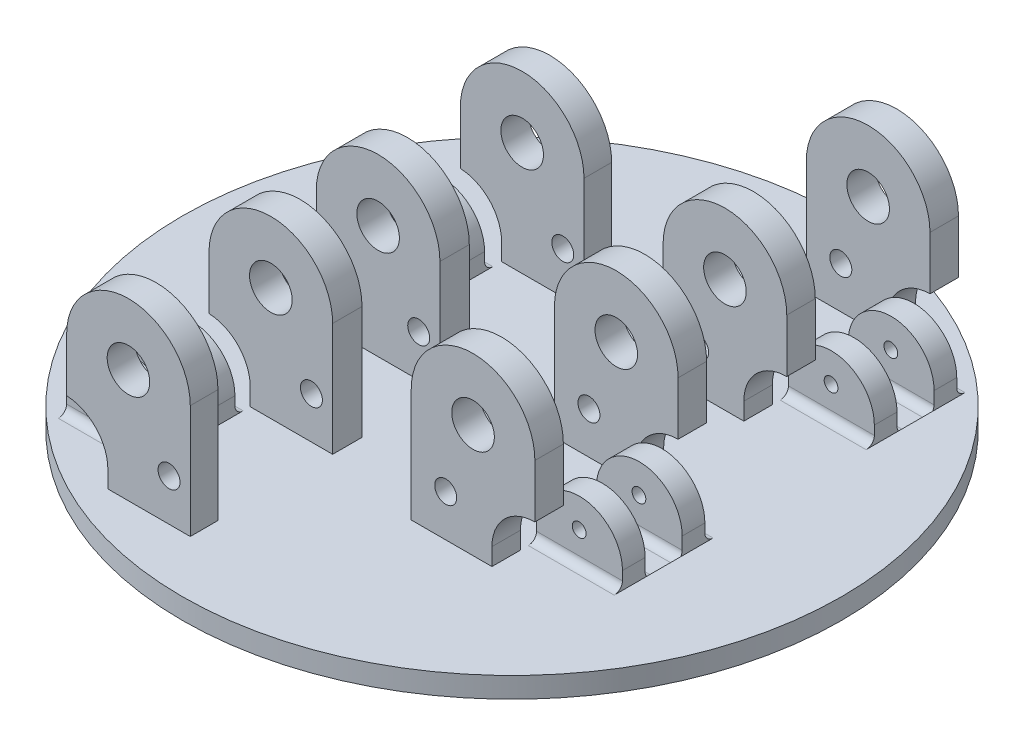
from build123d import *

# Parameters (mm, degrees)
SKETCH_1_R           = 48
SKETCH_1_R_2         = 1
EXTRUDE_1_DEPTH      = 2.5
SKETCH_11_W          = 18
SKETCH_11_H          = 25
EXTRUDE_13_DEPTH     = 26
CUT_EXTRUDE_19_DEPTH = 90.150131199
CUT_EXTRUDE_23_DEPTH = 26
SKETCH_12_10_R       = 3.1
SKETCH_12_10_R_2     = 1.6
CUT_EXTRUDE_24_DEPTH = 90.150131199
CUT_EXTRUDE_25_DEPTH = 90.150131199
CUT_EXTRUDE_26_DEPTH = 105.076574524
CUT_EXTRUDE_31_REACH = 102.393
CUT_EXTRUDE_30_REACH = 102.393
SKETCH_20_R          = 1
EXTRUDE_18_DEPTH     = 6
CUT_EXTRUDE_33_REACH = 107.214
SKETCH_21_W          = 5.4
SKETCH_21_H          = 18.025658934
SKETCH_24_R          = 3.1
SKETCH_24_R_2        = 1.6
CUT_EXTRUDE_35_DEPTH = 105.21252324
CUT_EXTRUDE_40_REACH = 102.393
SKETCH_26_W          = 16.7
SKETCH_26_H          = 31.404464931
SKETCH_27_R          = 1
EXTRUDE_20_DEPTH     = 6
CUT_EXTRUDE_41_REACH = 108.681
CUT_EXTRUDE_42_REACH = 90.175
EXTRUDE_21_DEPTH     = 11.5
SKETCH_35_R          = 1.4
CUT_EXTRUDE_43_DEPTH = 109.442477281
CUT_EXTRUDE_44_DEPTH = 80.369297247
EXTRUDE_22_DEPTH     = 8
FILLET_9_R           = 2
CUT_EXTRUDE_45_REACH = 98.187
FILLET_10_R          = 2
CUT_EXTRUDE_46_REACH = 96.57
FILLET_12_R          = 1.2
SKETCH_40_R          = 48
SKETCH_40_W          = 12.5
SKETCH_40_H          = 5.4
SKETCH_40_W_2        = 12.499987058
EXTRUDE_23_DEPTH     = 0.5
FILLET_13_R          = 1.2


with BuildPart() as part:
    # 草图1 → 凸台-拉伸1 (new body)
    with BuildSketch(Plane(origin=(0, 0, 0), x_dir=(1, 0, 0), z_dir=(0, 1, 0))):
        with Locations(Location((0, -14.75, 0), (0, 0, 270))):
            Circle(SKETCH_1_R)
        with Locations(Location((-27, -5.58, 0), (0, 0, 270))):
            Circle(SKETCH_1_R_2, mode=Mode.SUBTRACT)
        with Locations(Location((-27, -42.25, 0), (0, 0, 270))):
            Circle(SKETCH_1_R_2, mode=Mode.SUBTRACT)
        with Locations(Location((27, 12.75, 0), (0, 0, 270))):
            Circle(SKETCH_1_R_2, mode=Mode.SUBTRACT)
        with Locations(Location((27, -23.92, 0), (0, 0, 270))):
            Circle(SKETCH_1_R_2, mode=Mode.SUBTRACT)
    extrude(amount=EXTRUDE_1_DEPTH)

    # 草图11 → 凸台-拉伸13 (add)
    with BuildSketch(Plane(origin=(0, 2.5, 0), x_dir=(1, 0, 0), z_dir=(0, 1, 0))):
        with Locations((-16, -5.741037321)):
            Rectangle(SKETCH_11_W, SKETCH_11_H)
        with Locations((-16, -42.088962679)):
            Rectangle(SKETCH_11_W, SKETCH_11_H)
        with Locations((16, 12.75)):
            Rectangle(SKETCH_11_W, SKETCH_11_H)
        with Locations((16, -23.92)):
            Rectangle(SKETCH_11_W, SKETCH_11_H)
    extrude(amount=EXTRUDE_13_DEPTH)

    # 草图12 → 切除-拉伸19 (cut, through all)
    with BuildSketch(Plane(origin=(0, 0, -6.758962679), x_dir=(-1, 0, 0), z_dir=(0, 0, -1))):
        with BuildLine():
            ThreePointArc((7, 19.5), (9.636038969, 25.863961031), (16, 28.5))
            Line((16, 28.5), (7, 28.5))
            Line((7, 28.5), (7, 19.5))
        make_face()
    extrude(amount=-CUT_EXTRUDE_19_DEPTH, mode=Mode.SUBTRACT)

    # 草图12<9> → 切除-拉伸23 (cut)
    with BuildSketch(Plane(origin=(0, 0, -6.758962679), x_dir=(-1, 0, 0), z_dir=(0, 0, -1))):
        with BuildLine():
            ThreePointArc((16, 28.5), (22.363961031, 25.863961031), (25, 19.5))
            Line((25, 19.5), (25, 28.5))
            Line((25, 28.5), (16, 28.5))
        make_face()
    extrude(amount=-CUT_EXTRUDE_23_DEPTH, mode=Mode.SUBTRACT)

    # 草图12<10> → 切除-拉伸24 (cut, through all)
    with BuildSketch(Plane(origin=(0, 0, -6.758962679), x_dir=(-1, 0, 0), z_dir=(0, 0, -1))):
        with Locations((16, 19.5)):
            Circle(SKETCH_12_10_R)
        with Locations((10.09, 9.09)):
            Circle(SKETCH_12_10_R_2)
    extrude(amount=-CUT_EXTRUDE_24_DEPTH, mode=Mode.SUBTRACT)

    # 草图12<11> → 切除-拉伸25 (cut, through all)
    with BuildSketch(Plane(origin=(0, 0, -6.758962679), x_dir=(-1, 0, 0), z_dir=(0, 0, -1))):
        with BuildLine():
            Line((25, 2.5), (25, 11.744997998))
            ThreePointArc((25, 11.744997998), (20.743060906, 9.830127019), (19, 5.5))
            Line((19, 5.5), (19, 2.5))
            Line((19, 2.5), (25, 2.5))
        make_face()
    extrude(amount=-CUT_EXTRUDE_25_DEPTH, mode=Mode.SUBTRACT)

    # 草图13 → 切除-拉伸26 (cut, through all)
    with BuildSketch(Plane.XY.offset(54.588962679)):
        with BuildLine():
            Line((-25, 19.5), (-25, 28.5))
            Line((-25, 28.5), (-16, 28.5))
            ThreePointArc((-16, 28.5), (-22.363961031, 25.863961031), (-25, 19.5))
        make_face()
    extrude(amount=-CUT_EXTRUDE_26_DEPTH, mode=Mode.SUBTRACT)

    # 草图17 → 切除-拉伸31 (cut, up to next)
    with BuildSketch(Plane.ZY.offset(25), mode=Mode.PRIVATE) as cut_extrude_31_sk1:
        Polygon((50.559935794, 10.244997998), (50.559935794, 33.039194052), (33.859935794, 33.039194052), (33.859935794, 10.244997998), (33.859935794, 2.5), (50.559935794, 2.5), align=None)
    cut_extrude_31_tool1 = extrude(cut_extrude_31_sk1.sketch, amount=-CUT_EXTRUDE_31_REACH, mode=Mode.PRIVATE) & part.part
    add(cut_extrude_31_tool1.solids().sort_by_distance((-25, 17.769597, 42.209936))[0], mode=Mode.SUBTRACT)

    # 草图16 → 切除-拉伸30 (cut, up to next)
    with BuildSketch(Plane.ZY.offset(25), mode=Mode.PRIVATE) as cut_extrude_30_sk1:
        Polygon((13.970064206, 10.244997998), (13.970064206, 31.921887842), (-2.729935794, 31.921887842), (-2.729935794, 10.244997998), (-2.729935794, 2.5), (13.970064206, 2.5), align=None)
    cut_extrude_30_tool1 = extrude(cut_extrude_30_sk1.sketch, amount=-CUT_EXTRUDE_30_REACH, mode=Mode.PRIVATE) & part.part
    add(cut_extrude_30_tool1.solids().sort_by_distance((-25, 17.210944, 5.620064))[0], mode=Mode.SUBTRACT)

    # 草图20 → 凸台-拉伸18 (add, symmetric)
    with BuildSketch(Plane(origin=(0, 0, 5.741037321), x_dir=(-1, 0, 0), z_dir=(0, 0, -1))):
        with BuildLine():
            Line((31.5, 2.5), (19, 2.5))
            Line((19, 2.5), (19, 5.5))
            ThreePointArc((19, 5.5), (20.743060906, 9.830127019), (25, 11.744997998))
            ThreePointArc((25, 11.744997998), (29.580127019, 10.006939094), (31.5, 5.5))
            Line((31.5, 5.5), (31.5, 2.5))
        make_face()
        with Locations((25.314451677, 7.498961226)):
            Circle(SKETCH_20_R, mode=Mode.SUBTRACT)
    extrude_18 = extrude(amount=EXTRUDE_18_DEPTH, both=True)

    # 草图21 → 切除-拉伸33 (cut, up to next)
    with BuildSketch(Plane.ZY.offset(31.5), mode=Mode.PRIVATE) as cut_extrude_33_sk1:
        with Locations((5.795064206, 11.512829467)):
            Rectangle(SKETCH_21_W, SKETCH_21_H)
    cut_extrude_33_tool1 = extrude(cut_extrude_33_sk1.sketch, amount=-CUT_EXTRUDE_33_REACH, mode=Mode.PRIVATE) & part.part
    cut_extrude_33 = cut_extrude_33_tool1.solids().sort_by_distance((-31.5, 11.512829, 5.795064))[0]
    add(cut_extrude_33, mode=Mode.SUBTRACT)

    # 镜向2: 凸台-拉伸18 across plane
    add(extrude_18.mirror(Plane(origin=(0, 0, 23.915), x_dir=(1, 0, 0), z_dir=(0, 0, -1))))

    # 镜向5: 切除-拉伸33 across plane
    add(cut_extrude_33.mirror(Plane(origin=(0, 0, 23.915), x_dir=(1, 0, 0), z_dir=(0, 0, -1))), mode=Mode.SUBTRACT)

    # 草图24 → 切除-拉伸35 (cut, through all)
    with BuildSketch(Plane(origin=(0, 0, -25.25), x_dir=(-1, 0, 0), z_dir=(0, 0, -1))):
        with BuildLine():
            Line((-15.999999984, 28.5), (-25, 28.5))
            Line((-25, 28.5), (-25, 19.5))
            ThreePointArc((-25, 19.5), (-22.363961025, 25.863961036), (-15.999999984, 28.5))
        make_face()
        with BuildLine():
            Line((-7, 28.5), (-15.999999984, 28.5))
            ThreePointArc((-15.999999984, 28.5), (-9.636038964, 25.863961025), (-7, 19.5))
            Line((-7, 19.5), (-7, 28.5))
        make_face()
        with BuildLine():
            ThreePointArc((-18.750012942, 5.512719086), (-20.585081784, 9.923911973), (-25, 11.75))
            Line((-25, 11.75), (-25, 2.5))
            Line((-25, 2.5), (-18.750012942, 2.5))
            Line((-18.750012942, 2.5), (-18.750012942, 5.512719086))
        make_face()
        with Locations((-16, 19.5)):
            Circle(SKETCH_24_R)
        with Locations((-12.020744663, 9.09)):
            Circle(SKETCH_24_R_2)
    extrude(amount=-CUT_EXTRUDE_35_DEPTH, mode=Mode.SUBTRACT)

    # 切除-拉伸40: up to this face of the body (flat: up to its plane)
    cut_extrude_40_end = Plane(part.part.faces().sort_by_distance((7, 11, 23.92))[0])
    # 草图26 → 切除-拉伸40 (cut, up to the picked face)
    with BuildSketch(Plane(origin=(25, 0, 0), x_dir=(0, 0, -1), z_dir=(1, 0, 0)), mode=Mode.PRIVATE) as cut_extrude_40_sk1:
        with Locations((-23.92, 18.202232465)):
            Rectangle(SKETCH_26_W, SKETCH_26_H)
    cut_extrude_40_tool1 = split(extrude(cut_extrude_40_sk1.sketch, amount=-CUT_EXTRUDE_40_REACH, mode=Mode.PRIVATE), bisect_by=cut_extrude_40_end, keep=Keep.BOTH, mode=Mode.PRIVATE)
    add(cut_extrude_40_tool1.solids().sort_by(Axis((25, 18.202232, 23.92), (-1, 0, 0)))[0], mode=Mode.SUBTRACT)

    # 草图27 → 凸台-拉伸20 (add, symmetric)
    with BuildSketch(Plane(origin=(0, 0, 23.92), x_dir=(-1, 0, 0), z_dir=(0, 0, -1))):
        with BuildLine():
            ThreePointArc((-25, 11.75), (-29.419417382, 9.919417382), (-31.25, 5.5))
            Line((-31.25, 5.5), (-31.25, 2.5))
            Line((-31.25, 2.5), (-18.750012942, 2.5))
            Line((-18.750012942, 2.5), (-18.750012942, 5.512719086))
            ThreePointArc((-18.750012942, 5.512719086), (-20.585081784, 9.923911973), (-25, 11.75))
        make_face()
        with Locations((-24.950815636, 7.499395133)):
            Circle(SKETCH_27_R, mode=Mode.SUBTRACT)
    extrude_20 = extrude(amount=EXTRUDE_20_DEPTH, both=True)

    # 草图28 → 切除-拉伸41 (cut, up to next)
    with BuildSketch(Plane(origin=(33.430744663, 0, 0), x_dir=(0, 0, -1), z_dir=(1, 0, 0)), mode=Mode.PRIVATE) as cut_extrude_41_sk1:
        Polygon((-23.92, 2.5), (-21.22, 2.5), (-21.22, 12.964203296), (-26.62, 12.964203296), (-26.62, 2.5), align=None)
    cut_extrude_41_tool1 = extrude(cut_extrude_41_sk1.sketch, amount=-CUT_EXTRUDE_41_REACH, mode=Mode.PRIVATE) & part.part
    cut_extrude_41 = cut_extrude_41_tool1.solids().sort_by_distance((33.430745, 7.732102, 23.92))[0]
    add(cut_extrude_41, mode=Mode.SUBTRACT)

    # 切除-拉伸42: up to this face of the body (flat: up to its plane)
    cut_extrude_42_end = Plane(part.part.faces().sort_by_distance((25, 15.625, -12.75))[0])
    # 草图29 → 切除-拉伸42 (cut, up to the picked face)
    with BuildSketch(Plane.ZY.offset(-7), mode=Mode.PRIVATE) as cut_extrude_42_sk1:
        Polygon((-12.75, 2.5), (-21.1, 2.5), (-21.1, 15.891305855), (-21.1, 43.928823356), (-4.4, 43.928823356), (-4.4, 15.891305855), (-4.4, 2.5), align=None)
    cut_extrude_42_tool1 = split(extrude(cut_extrude_42_sk1.sketch, amount=-CUT_EXTRUDE_42_REACH, mode=Mode.PRIVATE), bisect_by=cut_extrude_42_end, keep=Keep.BOTH, mode=Mode.PRIVATE)
    add(cut_extrude_42_tool1.solids().sort_by(Axis((7, 23.214412, -12.75), (1, 0, 0)))[0], mode=Mode.SUBTRACT)

    # 镜向11: 凸台-拉伸20, 切除-拉伸41 across plane
    add(extrude_20.mirror(Plane(origin=(0, 0, 5.585), x_dir=(1, 0, 0), z_dir=(0, 0, -1))))
    add(cut_extrude_41.mirror(Plane(origin=(0, 0, 5.585), x_dir=(1, 0, 0), z_dir=(0, 0, -1))), mode=Mode.SUBTRACT)

    # 草图34 → 凸台-拉伸21 (add)
    with BuildSketch(Plane.XZ):
        Polygon((14.683251018, 1.895345608), (-19.361198294, 12.303778296), (-18.48408318, 15.172692564), (15.560366133, 4.764259876), align=None)
        Polygon((-28.132349436, -16.385364383), (5.912099877, -26.793797071), (5.034984763, -29.662711339), (-29.00946455, -19.25427865), align=None)
    extrude(amount=EXTRUDE_21_DEPTH)

    # 草图35 → 切除-拉伸43 (cut, through all)
    with BuildSketch(Plane(origin=(-7.863192231, 0, -25.719342897), x_dir=(-0.9563047559630374, 0, 0.2923717047227303), z_dir=(-0.2923717047227303, 0, -0.9563047559630374))):
        with Locations(Location((19.312482645, -9.1, 0), (0, 0, 180))):
            Circle(SKETCH_35_R)
        with Locations(Location((12.812482645, -2.8, 0), (0, 0, 180))):
            Circle(SKETCH_35_R)
        with Locations((-4.187517355, -2.8)):
            Circle(SKETCH_35_R)
        with Locations((-10.687517355, -9.1)):
            Circle(SKETCH_35_R)
    extrude(amount=-CUT_EXTRUDE_43_DEPTH, mode=Mode.SUBTRACT)

    # 草图36 → 切除-拉伸44 (cut, through all)
    with BuildSketch(Plane(origin=(2.662189139, 0, 8.707628318), x_dir=(0.9563047559630374, 0, -0.29237170472273044), z_dir=(0.29237170472273044, 0, 0.9563047559630374))):
        Polygon((-10.612482645, 0), (-10.612482645, -5.6), (-16.512482645, -5.6), (-16.512482645, -11.5), (7.887517355, -11.5), (7.887517355, -5.6), (1.987517355, -5.6), (1.987517355, 0), align=None)
    extrude(amount=-CUT_EXTRUDE_44_DEPTH, mode=Mode.SUBTRACT)

    # 草图37 → 凸台-拉伸22 (add)
    with BuildSketch(Plane.XZ):
        Polygon((-18.48408318, 15.172692564), (-29.00946455, -19.25427865), (-30.730813111, -18.728009582), (-20.20543174, 15.698961633), align=None)
        Polygon((5.034984763, -29.662711339), (15.560366133, 4.764259876), (17.281714693, 4.237990808), (6.756333323, -30.188980407), align=None)
    extrude(amount=EXTRUDE_22_DEPTH)

    # 圆角9
    fillet_9_edges = [part.edges().sort_by_distance(p)[0] for p in [
        (4.124303882, -5.6, 6.692077346),
        (9.766501942, -11.5, 4.967084289),
        (-13.567334103, -5.6, 12.100953884),
        (-7.925136043, -5.6, 10.375960826),
        (9.766501942, -5.6, 4.967084289),
        (-13.567334103, -11.5, 12.100953884),
    ]]
    fillet(fillet_9_edges, radius=FILLET_9_R)

    # 草图38 → 切除-拉伸45 (cut, up to next)
    with BuildSketch(Plane(origin=(14.619525554, 0, -4.46963751), x_dir=(-0.29237170472273, 0, -0.9563047559630375), z_dir=(0.9563047559630375, 0, -0.29237170472273)), mode=Mode.PRIVATE) as cut_extrude_45_sk1:
        with BuildLine():
            Line((-0.788709082, -2.2), (19.211290918, -2.2))
            ThreePointArc((19.211290918, -2.2), (21.011290918, -4), (19.211290918, -5.8))
            Line((19.211290918, -5.8), (-0.788709082, -5.8))
            ThreePointArc((-0.788709082, -5.8), (-2.588709082, -4), (-0.788709082, -2.2))
        make_face()
    cut_extrude_45_tool1 = extrude(cut_extrude_45_sk1.sketch, amount=-CUT_EXTRUDE_45_REACH, mode=Mode.PRIVATE) & part.part
    add(cut_extrude_45_tool1.solids().sort_by_distance((11.926405, -4, -13.278439))[0], mode=Mode.SUBTRACT)

    # 圆角10
    fillet_10_edges = [part.edges().sort_by_distance(p)[0] for p in [
        (-23.215600359, -11.5, -19.457103063),
        (0.118235686, -11.5, -26.590972658),
        (-5.523962374, -5.6, -24.8659796),
        (-23.215600359, -5.6, -19.457103063),
        (-17.573402299, -5.6, -21.182096121),
        (0.118235686, -5.6, -26.590972658),
    ]]
    fillet(fillet_10_edges, radius=FILLET_10_R)

    # 草图39 → 切除-拉伸46 (cut, up to next)
    with BuildSketch(Plane(origin=(-22.86762088, 0, 6.991333315), x_dir=(0.2923717047227303, 0, 0.9563047559630375), z_dir=(-0.9563047559630375, 0, 0.2923717047227303)), mode=Mode.PRIVATE) as cut_extrude_46_sk1:
        with BuildLine():
            Line((6.10549515, -8), (6.10549515, 0))
            Line((6.10549515, 0), (-11.89450485, 0))
            Line((-11.89450485, 0), (-11.89450485, -1.709954366))
            add(Edge.make_bspline(
                [(-11.89450485, -1.709954366), (-12.35365564, -6.550000985), (-7.327973055, -8)],
                knots=[0, 0, 0, 1, 1, 1], degree=2))
            Line((-7.327973055, -8), (6.10549515, -8))
        make_face()
    cut_extrude_46_tool1 = extrude(cut_extrude_46_sk1.sketch, amount=-CUT_EXTRUDE_46_REACH, mode=Mode.PRIVATE) & part.part
    add(cut_extrude_46_tool1.solids().sort_by_distance((-23.614558, -3.873963, 4.548213))[0], mode=Mode.SUBTRACT)

    # 圆角12
    fillet_12_edges = [part.edges().sort_by_distance(p)[0] for p in [
        (0.396906696, 0, -28.244708571),
        (-24.371386483, 0, -20.672281418),
        (-13.846005113, 0, 13.754689796),
        (10.922288066, 0, 6.182262644),
        (-18.922640737, -8, 13.73823543),
        (12.019024008, 0, -12.9754948),
        (-28.538025325, 0, -11.555723912),
        (-28.570906993, -8, -17.819821516),
        (15.121808575, -8, 3.329802742),
        (5.47354232, -8, -28.228254205),
        (-5.523962374, 0, -24.8659796),
        (-17.573402299, 0, -21.182096121),
    ]]
    fillet(fillet_12_edges, radius=FILLET_12_R)

    # 草图40 → 凸台-拉伸23 (add)
    with BuildSketch(Plane(origin=(0, 2.5, 0), x_dir=(1, 0, 0), z_dir=(0, 1, 0))):
        with Locations(Location((0, -14.75, 0), (0, 0, 270))):
            Circle(SKETCH_40_R)
        with Locations((-25.25, -42.034935794)):
            Rectangle(SKETCH_40_W, SKETCH_40_H, mode=Mode.SUBTRACT)
        with Locations((25.000006471, -23.92)):
            Rectangle(SKETCH_40_W_2, SKETCH_40_H, mode=Mode.SUBTRACT)
        with Locations((25.000006471, 12.75)):
            Rectangle(SKETCH_40_W_2, SKETCH_40_H, mode=Mode.SUBTRACT)
        with Locations((-25.25, -5.795064206)):
            Rectangle(SKETCH_40_W, SKETCH_40_H, mode=Mode.SUBTRACT)
    extrude(amount=EXTRUDE_23_DEPTH)

    # 圆角13
    # the kernel refuses this fillet: 1.2 mm, written as the material it adds along each edge
    with BuildSketch(Plane(origin=(-31.5, 2.5, 8.495064206), x_dir=(0, 0, -1), z_dir=(1, 0, 0)), Plane(origin=(-31.5, 2.5, 3.095064206), x_dir=(0, 1, 0), z_dir=(1, 0, 0)), Plane(origin=(-31.5, 2.5, 39.334935794), x_dir=(0, 1, 0), z_dir=(1, 0, 0)), Plane(origin=(-31.5, 2.5, 44.734935794), x_dir=(0, 0, -1), z_dir=(1, 0, 0)), Plane(origin=(-19, 3, 48.088962679), x_dir=(0, 0, 1), z_dir=(-1, 0, 0)), Plane(origin=(-19, 3, 11.741037321), x_dir=(0, 0, 1), z_dir=(-1, 0, 0))) as fillet_13_piece_1:
        with BuildLine():
            CenterArc((FILLET_13_R, FILLET_13_R), FILLET_13_R, 180, 90)
            Line((0, FILLET_13_R), (0, 0))
            Line((0, 0), (FILLET_13_R, 0))
        make_face()
    extrude(amount=12.5)
    with BuildSketch(Plane(origin=(31.25, 2.5, 26.62), x_dir=(0, 0, -1), z_dir=(-1, 0, 0)), Plane(origin=(31.25, 2.5, 21.22), x_dir=(0, 1, 0), z_dir=(-1, 0, 0)), Plane(origin=(31.25, 2.5, -10.05), x_dir=(0, 0, -1), z_dir=(-1, 0, 0)), Plane(origin=(18.750012942, 3, -6.75), x_dir=(0, 0, 1), z_dir=(1, 0, 0)), Plane(origin=(18.750012942, 3, 29.92), x_dir=(0, 0, 1), z_dir=(1, 0, 0)), Plane(origin=(18.750012942, 3, -18.75), x_dir=(0, 1, 0), z_dir=(1, 0, 0))) as fillet_13_piece_2:
        with BuildLine():
            CenterArc((FILLET_13_R, -FILLET_13_R), FILLET_13_R, 90, 90)
            Line((0, -FILLET_13_R), (0, 0))
            Line((0, 0), (FILLET_13_R, 0))
        make_face()
    extrude(amount=12.499987058)
    with BuildSketch(Plane(origin=(31.25, 2.5, -15.45), x_dir=(0, 0, 1), z_dir=(-1, 0, 0)), Plane(origin=(18.750012942, 3, 17.92), x_dir=(0, 0, -1), z_dir=(1, 0, 0))) as fillet_13_piece_3:
        with BuildLine():
            CenterArc((FILLET_13_R, FILLET_13_R), FILLET_13_R, 180, 90)
            Line((0, FILLET_13_R), (0, 0))
            Line((0, 0), (FILLET_13_R, 0))
        make_face()
    extrude(amount=12.499987058)
    with BuildSketch(Plane(origin=(-19, 3, -0.258962679), x_dir=(0, 0, -1), z_dir=(-1, 0, 0)), Plane(origin=(-19, 3, 36.088962679), x_dir=(0, 0, -1), z_dir=(-1, 0, 0))) as fillet_13_piece_4:
        with BuildLine():
            CenterArc((FILLET_13_R, -FILLET_13_R), FILLET_13_R, 90, 90)
            Line((0, -FILLET_13_R), (0, 0))
            Line((0, 0), (FILLET_13_R, 0))
        make_face()
    extrude(amount=12.5)


solid = part.part
